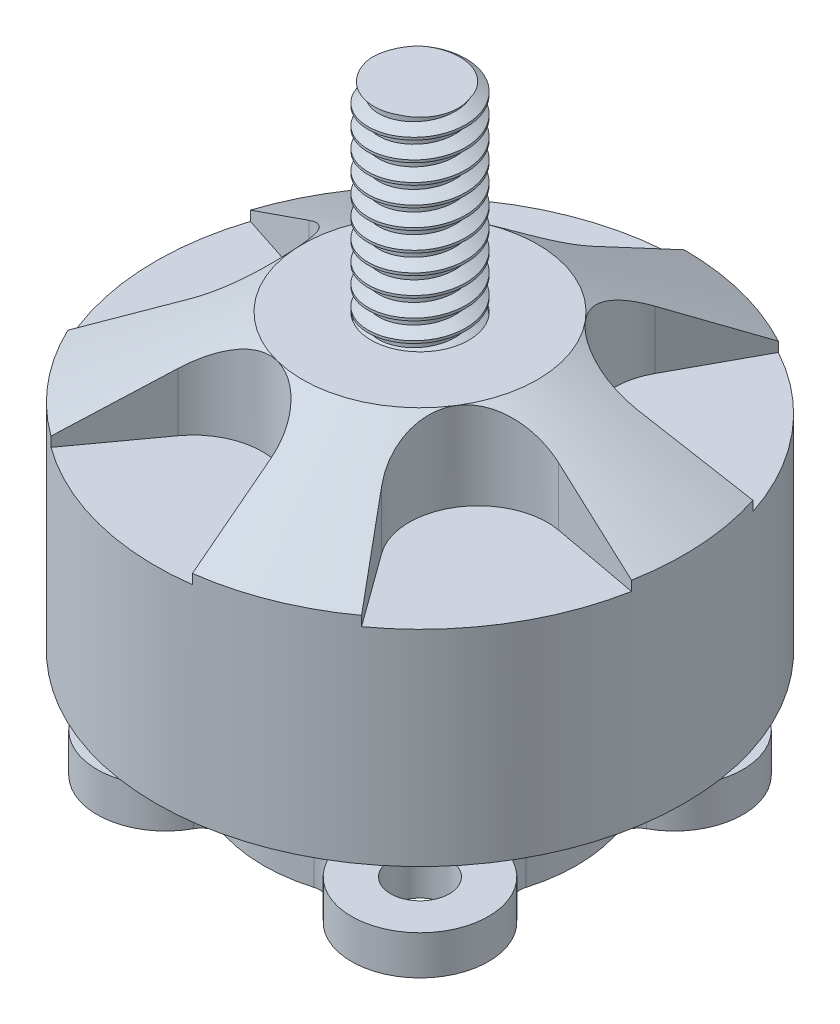
from build123d import *
from build123d.topology import SkipClean

# Parameters (mm, degrees)
SKETCH3_R           = 1.5
BOSS_EXTRUDE3_DEPTH = 2
FILLET1_R           = 1
SKETCH4_R           = 5
BOSS_EXTRUDE4_DEPTH = 3.5
SKETCH1_R           = 13.5
BOSS_EXTRUDE5_DEPTH = 15
SKETCH5_R           = 2.5
BOSS_EXTRUDE6_DEPTH = 10
FILLET3_R           = 1.5
THREAD1_PITCH       = 1
CUT_EXTRUDE2_START  = -4.5
CUT_EXTRUDE2_DEPTH  = 4.5
CIRPATTERN1_COUNT   = 5


with BuildPart() as part:
    # Sketch3 → Boss-Extrude3 (new body)
    with BuildSketch(Plane(origin=(0, 0, 0), x_dir=(1, 0, 0), z_dir=(0, 1, 0))):
        with BuildLine():
            ThreePointArc((7.370729443, 3.110039788), (8.974873734, 8.974873734), (3.110039788, 7.370729443))
            ThreePointArc((3.110039788, 7.370729443), (0, 8), (-3.110039788, 7.370729443))
            ThreePointArc((-3.110039788, 7.370729443), (-8.974873734, 8.974873734), (-7.370729443, 3.110039788))
            ThreePointArc((-7.370729443, 3.110039788), (-8, 0), (-7.370729443, -3.110039788))
            ThreePointArc((-7.370729443, -3.110039788), (-8.974873734, -8.974873734), (-3.110039788, -7.370729443))
            ThreePointArc((-3.110039788, -7.370729443), (0, -8), (3.110039788, -7.370729443))
            ThreePointArc((3.110039788, -7.370729443), (8.974873734, -8.974873734), (7.370729443, -3.110039788))
            ThreePointArc((7.370729443, -3.110039788), (8, 0), (7.370729443, 3.110039788))
        make_face()
        with Locations(Location((6.5, 6.5, 0), (0, 0, 270))):
            Circle(SKETCH3_R, mode=Mode.SUBTRACT)
        with Locations(Location((6.5, -6.5, 0), (0, 0, 270))):
            Circle(SKETCH3_R, mode=Mode.SUBTRACT)
        with Locations(Location((-6.5, -6.5, 0), (0, 0, 270))):
            Circle(SKETCH3_R, mode=Mode.SUBTRACT)
        with Locations(Location((-6.5, 6.5, 0), (0, 0, 270))):
            Circle(SKETCH3_R, mode=Mode.SUBTRACT)
    extrude(amount=BOSS_EXTRUDE3_DEPTH)

    # Fillet1
    fillet1_edges = [part.edges().sort_by_distance(p)[0] for p in [
        (7.370729443, 1, 3.110039788),
        (3.110039788, 1, 7.370729443),
        (-3.110039788, 1, 7.370729443),
        (-7.370729443, 1, 3.110039788),
        (-7.370729443, 1, -3.110039788),
        (-3.110039788, 1, -7.370729443),
        (3.110039788, 1, -7.370729443),
        (7.370729443, 1, -3.110039788),
    ]]
    fillet(fillet1_edges, radius=FILLET1_R)

    # Sketch4 → Boss-Extrude4 (add)
    with BuildSketch(Plane(origin=(0, 2, 0), x_dir=(1, 0, 0), z_dir=(0, 1, 0))):
        with Locations(Location((0, 0, 0), (0, 0, 270))):
            Circle(SKETCH4_R)
    extrude(amount=BOSS_EXTRUDE4_DEPTH)

    # Sketch1 → Boss-Extrude5 (add)
    with BuildSketch(Plane(origin=(0, 5.5, 0), x_dir=(1, 0, 0), z_dir=(0, 1, 0))):
        with Locations(Location((0, 0, 0), (0, 0, 270))):
            Circle(SKETCH1_R)
    extrude(amount=BOSS_EXTRUDE5_DEPTH)

    # Sketch5 → Boss-Extrude6 (add)
    with BuildSketch(Plane(origin=(0, 20.5, 0), x_dir=(1, 0, 0), z_dir=(0, 1, 0))):
        with Locations(Location((0, 0, 0), (0, 0, 270))):
            Circle(SKETCH5_R)
    extrude(amount=BOSS_EXTRUDE6_DEPTH)

    # Fillet3
    fillet3_edges = [part.edges().sort_by_distance(p)[0] for p in [
        (0, 2, -5),
    ]]
    fillet(fillet3_edges, radius=FILLET3_R)

    # Thread1: the profile of Thread Profile1 profile screwed along a right-hand helix of 15 turns, 8 arcs to a turn; built about Z, then put on its axis
    thread1_z = Axis((0, 0, 0), (0, 0, 1))
    thread1_corners = [(2.5003, 0, -0.000173205), (2.5003, 0, 0.875173202), (1.958734125, 0, 0.562499999), (1.958734125, 0, 0.312499999)]
    with BuildLine(mode=Mode.PRIVATE) as thread1_profile:
        Line(thread1_corners[0], thread1_corners[1])
        Line(thread1_corners[1], thread1_corners[2])
        Line(thread1_corners[2], thread1_corners[3])
        Line(thread1_corners[3], thread1_corners[0])
    thread1_cap = Face(thread1_profile.wire())
    thread1_turn_angles = [0, 22.5, 45, 67.5, 90, 112.5, 135, 157.5, 180, 202.5, 225, 247.5, 270, 292.5, 315, 337.5, 360]
    thread1_turn_weights = [1, 0.9238795325112867, 1, 0.9238795325112867, 1, 0.9238795325112867, 1, 0.9238795325112867, 1, 0.9238795325112867, 1, 0.9238795325112867, 1, 0.9238795325112867, 1, 0.9238795325112867, 1]
    thread1_turn_rails = [Edge.make_bspline([Vector(p[0], p[1], 0).rotate(thread1_z, thread1_turn_angles[k]) / thread1_turn_weights[k] + Vector(0, 0, p[2] + THREAD1_PITCH * thread1_turn_angles[k] / 360) for k in range(17)], [0, 0, 0, 1, 1, 2, 2, 3, 3, 4, 4, 5, 5, 6, 6, 7, 7, 8, 8, 8], 2, thread1_turn_weights) for p in thread1_corners]
    thread1_turn_sides = [Face.make_surface_from_curves(thread1_turn_rails[p[0]], thread1_turn_rails[p[1]]) for p in [(0, 1), (1, 2), (2, 3), (3, 0)]]
    thread1 = Plane(origin=(0, 32.5, 0), x_dir=(-1, 0, 0), z_dir=(0, -1, 0)) * Solid(Shell([*[p.moved(Location((0, 0, THREAD1_PITCH * i))) for i in range(15) for p in thread1_turn_sides], thread1_cap, thread1_cap.rotate(thread1_z, 5400).moved(Location((0, 0, THREAD1_PITCH * 5400 / 360)))]))
    add(thread1, mode=Mode.SUBTRACT)

    # Sketch6 → Cut-Revolve1 (revolve, cut)
    with BuildSketch(Plane(origin=(0, 0, 0), x_dir=(0, 0, -1), z_dir=(1, 0, 0))):
        Polygon((-13.5, 16.5), (-6, 20.5), (-13.5, 20.5), align=None)
    revolve(axis=Axis((0, 20.5, 0), (0, -1, 0)), mode=Mode.SUBTRACT)

    # Sketch7 → Cut-Extrude2 (cut)
    with SkipClean():  # the faces are left unmerged after this step: merging them gives an invalid solid
        with BuildSketch(Plane(origin=(0, 20.5, 0), x_dir=(1, 0, 0), z_dir=(0, 1, 0)).offset(CUT_EXTRUDE2_START)):
            with BuildLine():
                ThreePointArc((-6.090534979, 6.423264345), (-4.286838431, 5.40453934), (-2.222222236, 5.573304974))
                Line((-2.222222222, 5.57330498), (-5, 12.539936204))
                ThreePointArc((-5, 12.539936204), (-7.274932219, 11.3721309), (-9.288841633, 9.796296296))
                Line((-9.288841633, 9.796296296), (-6.090534979, 6.423264345))
            make_face()
            with BuildLine():
                Line((-5, 12.539936204), (-2.222222222, 5.57330498))
                ThreePointArc((-2.222222236, 5.573304974), (-0.60790894, 6.871424581), (0, 8.851719673))
                Line((0, 8.851719673), (0, 13.5))
                ThreePointArc((0, 13.5), (-2.545668993, 13.257811636), (-5, 12.539936204))
            make_face()
        cut_extrude2 = extrude(amount=CUT_EXTRUDE2_DEPTH, mode=Mode.SUBTRACT)

    # CirPattern1: Cut-Extrude2 ×5 about axis
    cirpattern1_axis = Axis((0, 0, 0), (0, 1, 0))
    for i in range(1, CIRPATTERN1_COUNT):
        add(cut_extrude2.rotate(cirpattern1_axis, i * 360 / CIRPATTERN1_COUNT), mode=Mode.SUBTRACT)


solid = part.part
